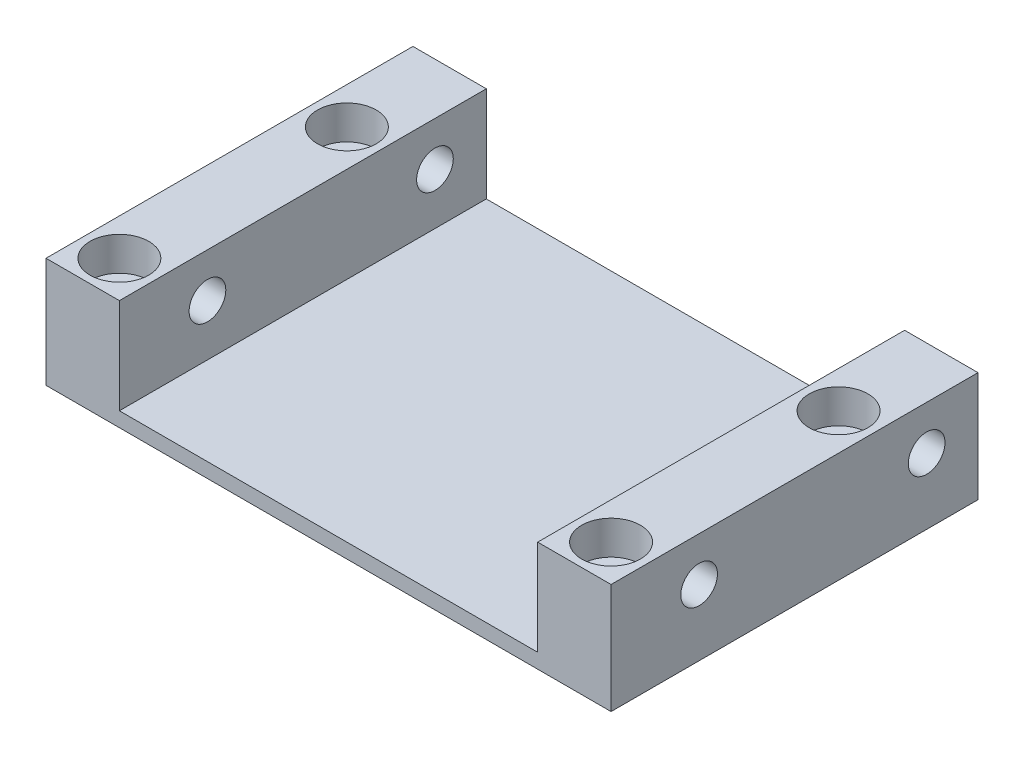
from build123d import *

# Parameters (mm, degrees)
EXTRUDE_1_DEPTH           = 25
SKETCH_4_R                = 2.5
CUT_EXTRUDE_1_DEPTH       = 50
HOLE_WIZARD_2_D           = 4.5
HOLE_WIZARD_2_CBORE_D     = 8
HOLE_WIZARD_2_CBORE_DEPTH = 4.6


with BuildPart() as part:
    # 草图1 → 凸台-拉伸1 (new, symmetric)
    with BuildSketch(Plane.XY):
        Polygon((-28.5, 2), (-28.5, 15), (-38.5, 15), (-38.5, 0), (38.5, 0), (38.5, 15), (28.5, 15), (28.5, 2), align=None)
    extrude(amount=EXTRUDE_1_DEPTH, both=True)

    # 草图4 → 切除-拉伸1 (cut, symmetric)
    with BuildSketch(Plane(origin=(0, 0, 0), x_dir=(0, 0, -1), z_dir=(1, 0, 0))):
        with Locations((18, 9)):
            Circle(SKETCH_4_R)
        with Locations((-13, 9)):
            Circle(SKETCH_4_R)
    extrude(amount=CUT_EXTRUDE_1_DEPTH, both=True, mode=Mode.SUBTRACT)

    # 打孔尺寸根据内六角圆柱头螺钉的类型2 (through all)
    with Locations(Plane(origin=(0, 15, 0), x_dir=(-1, 0, 0), z_dir=(0, 1, 0))):
        with Locations((33.5, -11), (33.5, 20)):
            hole_wizard_2 = CounterBoreHole(HOLE_WIZARD_2_D / 2, HOLE_WIZARD_2_CBORE_D / 2, HOLE_WIZARD_2_CBORE_DEPTH)

    # 镜向2: 打孔尺寸根据内六角圆柱头螺钉的类型2 across plane
    add(hole_wizard_2.mirror(Plane(origin=(0, 0, 0), x_dir=(0, 0, 1), z_dir=(1, 0, 0))), mode=Mode.SUBTRACT)


solid = part.part
